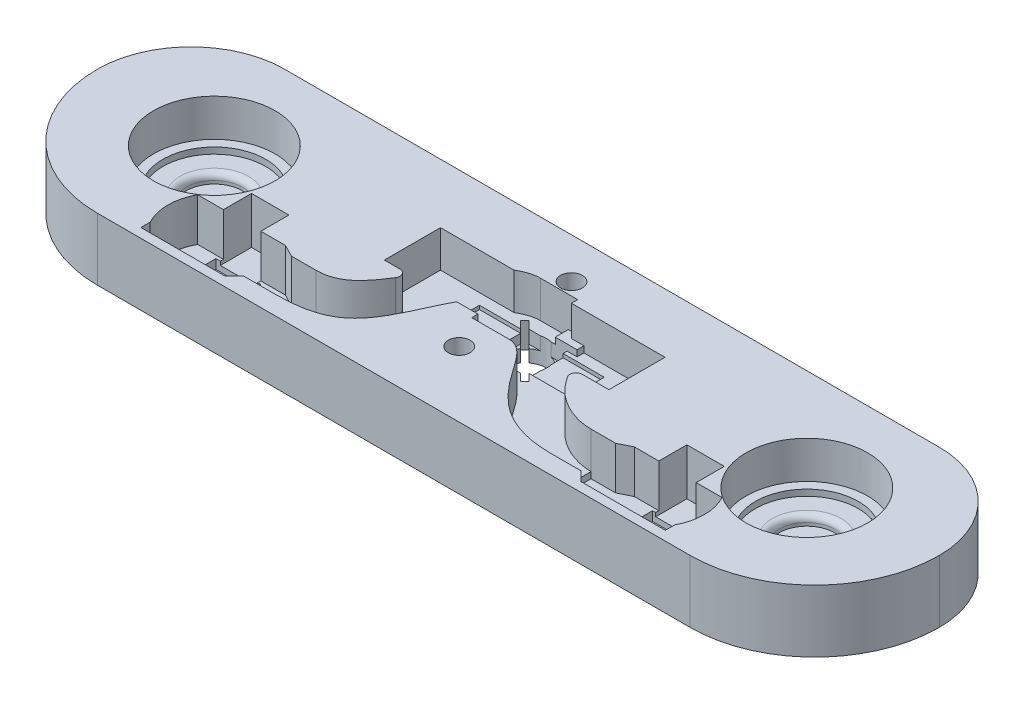
from build123d import *

# Parameters (mm, degrees)
SKETCH1_W                = 135
SKETCH1_H                = 35
BOSS_EXTRUDE1_DEPTH      = 10
FILLET1_R                = 20
CUT_EXTRUDE3_REACH       = 93.483
SKETCH5_R                = 1.75
SKETCH6_R                = 3.1
CUT_EXTRUDE4_DEPTH       = 4
FILLET2_R                = 15
SKETCH3_R                = 9.75
CUT_EXTRUDE5_DEPTH       = 7
BOSS_EXTRUDE2_START      = 1
SKETCH9_R                = 9.75
SKETCH9_R_2              = 8.25
BOSS_EXTRUDE2_DEPTH      = 1
SKETCH10_R               = 4.5
CUT_EXTRUDE6_DEPTH       = 1.5
FILLET3_R                = 1
CUT_EXTRUDE7_REACH       = 93.483
SKETCH7_R                = 2.5
SKETCH11_W               = 7.2
SKETCH11_H               = 6.2
CUT_EXTRUDE8_DEPTH       = 8.4
CUT_EXTRUDE9_DEPTH       = 6.9
CUT_EXTRUDE10_DEPTH      = 5.9
CUT_EXTRUDE11_REACH      = 93.483
SKETCH14_R               = 3.5
CUT_EXTRUDE12_DEPTH      = 5.9
CUT_EXTRUDE12_DEPTH_BACK = 2.1
SKETCH15_W               = 6.8
SKETCH15_H               = 6.8
SKETCH16_W               = 36
SKETCH16_H               = 9
CUT_EXTRUDE13_DEPTH      = 5.9
BOSS_EXTRUDE3_DEPTH      = 1
SKETCH18_W               = 6
SKETCH18_H               = 5
CUT_EXTRUDE14_DEPTH      = 7.5
SKETCH19_W               = 13
SKETCH19_H               = 1.5
CUT_EXTRUDE15_DEPTH      = 6.9
CHAMFER1_SIZE            = 2
FILLET4_R                = 1
CUT_EXTRUDE16_REACH      = 93.196
SKETCH20_R               = 0.7
CUT_EXTRUDE17_START      = -4.1
CUT_EXTRUDE17_DEPTH      = 10
SKETCH22_W               = 20
SKETCH22_H               = 5.5
CUT_EXTRUDE18_DEPTH      = 0.6


# Some blends are built 0.0001 mm under size
with BuildPart() as part:
    # Sketch1 → Boss-Extrude1 (new body)
    with BuildSketch(Plane(origin=(0, 0, 0), x_dir=(1, 0, 0), z_dir=(0, 1, 0))):
        with Locations((19.749798241, -8.123070146)):
            Rectangle(SKETCH1_W, SKETCH1_H)
    extrude(amount=BOSS_EXTRUDE1_DEPTH)

    # Fillet1
    fillet1_edges = [part.edges().sort_by_distance(p)[0] for p in [
        (87.249798241, 5, 25.623070146),
        (-47.750201759, 5, 25.623070146),
    ]]
    fillet(fillet1_edges, radius=FILLET1_R)

    # Sketch5 → Cut-Extrude3 (cut, up to next)
    with BuildSketch(Plane(origin=(0, 10, 0), x_dir=(1, 0, 0), z_dir=(0, 1, 0)), mode=Mode.PRIVATE) as cut_extrude3_sk1:
        with Locations(Location((19.749798241, 2.876929854, 0), (0, 0, 270))):
            Circle(SKETCH5_R)
    cut_extrude3_tool1 = extrude(cut_extrude3_sk1.sketch, amount=-CUT_EXTRUDE3_REACH, mode=Mode.PRIVATE) & part.part
    # Sketch5 → Cut-Extrude3 (cut, up to next)
    with BuildSketch(Plane(origin=(0, 10, 0), x_dir=(1, 0, 0), z_dir=(0, 1, 0)), mode=Mode.PRIVATE) as cut_extrude3_sk2:
        with Locations(Location((19.749798241, -15.123070146, 0), (0, 0, 270))):
            Circle(SKETCH5_R)
    cut_extrude3_tool2 = extrude(cut_extrude3_sk2.sketch, amount=-CUT_EXTRUDE3_REACH, mode=Mode.PRIVATE) & part.part
    add(cut_extrude3_tool1.solids().sort_by_distance((19.749798, 10, -2.87693))[0], mode=Mode.SUBTRACT)
    add(cut_extrude3_tool2.solids().sort_by_distance((19.749798, 10, 15.12307))[0], mode=Mode.SUBTRACT)

    # Sketch6 → Cut-Extrude4 (cut)
    with BuildSketch(Plane.XZ):
        with Locations(Location((19.749798241, 15.123070146, 0), (0, 0, 270))):
            Circle(SKETCH6_R)
        with Locations(Location((19.749798241, -2.876929854, 0), (0, 0, 270))):
            Circle(SKETCH6_R)
    extrude(amount=-CUT_EXTRUDE4_DEPTH, mode=Mode.SUBTRACT)

    # Fillet2
    fillet2_edges = [part.edges().sort_by_distance(p)[0] for p in [
        (-47.750201759, 5, -9.376929854),
        (87.249798241, 5, -9.376929854),
    ]]
    fillet(fillet2_edges, radius=FILLET2_R - 0.0001)  # a hair under: the kernel refuses the full size

    # Sketch3 → Cut-Extrude5 (cut)
    with BuildSketch(Plane(origin=(0, 10, 0), x_dir=(1, 0, 0), z_dir=(0, 1, 0))):
        with Locations(Location((-27.750201759, -6.88629089, 0), (0, 0, 270))):
            Circle(SKETCH3_R)
        with Locations(Location((67.249798241, -6.88629089, 0), (0, 0, 90))):
            Circle(SKETCH3_R)
    extrude(amount=-CUT_EXTRUDE5_DEPTH, mode=Mode.SUBTRACT)

    # Sketch9 → Boss-Extrude2 (add)
    # profile 1 of 2: a face of its own
    with BuildSketch(Plane(origin=(0, 3, 0), x_dir=(1, 0, 0), z_dir=(0, 1, 0)).offset(BOSS_EXTRUDE2_START)):
        with Locations(Location((-27.750201759, -6.88629089, 0), (0, 0, 270))):
            Circle(SKETCH9_R)
        with Locations(Location((-27.750201759, -6.88629089, 0), (0, 0, 270))):
            Circle(SKETCH9_R_2, mode=Mode.SUBTRACT)
    # profile 2 of 2: a face of its own
    with BuildSketch(Plane(origin=(0, 3, 0), x_dir=(1, 0, 0), z_dir=(0, 1, 0)).offset(BOSS_EXTRUDE2_START)):
        with Locations(Location((67.249798241, -6.88629089, 0), (0, 0, 270))):
            Circle(SKETCH9_R)
        with Locations(Location((67.249798241, -6.88629089, 0), (0, 0, 270))):
            Circle(SKETCH9_R_2, mode=Mode.SUBTRACT)
    extrude(amount=-BOSS_EXTRUDE2_DEPTH)

    # Sketch10 → Cut-Extrude6 (cut)
    with BuildSketch(Plane(origin=(0, 3, 0), x_dir=(1, 0, 0), z_dir=(0, 1, 0))):
        with Locations(Location((-27.750201759, -6.88629089, 0), (0, 0, 270))):
            Circle(SKETCH10_R)
        with Locations(Location((67.249798241, -6.88629089, 0), (0, 0, 270))):
            Circle(SKETCH10_R)
    extrude(amount=-CUT_EXTRUDE6_DEPTH, mode=Mode.SUBTRACT)

    # Fillet3
    fillet3_edges = [part.edges().sort_by_distance(p)[0] for p in [
        (-27.750201759, 3, 2.38629089),
        (67.249798241, 3, 2.38629089),
    ]]
    fillet(fillet3_edges, radius=FILLET3_R)

    # Sketch7 → Cut-Extrude7 (cut, up to next)
    with BuildSketch(Plane(origin=(0, 10, 0), x_dir=(1, 0, 0), z_dir=(0, 1, 0)), mode=Mode.PRIVATE) as cut_extrude7_sk1:
        with Locations(Location((-15.250201759, -18.623070146, 0), (0, 0, 270))):
            Circle(SKETCH7_R)
    cut_extrude7_tool1 = extrude(cut_extrude7_sk1.sketch, amount=-CUT_EXTRUDE7_REACH, mode=Mode.PRIVATE) & part.part
    # Sketch7 → Cut-Extrude7 (cut, up to next)
    with BuildSketch(Plane(origin=(0, 10, 0), x_dir=(1, 0, 0), z_dir=(0, 1, 0)), mode=Mode.PRIVATE) as cut_extrude7_sk2:
        with Locations(Location((54.749798241, -18.623070146, 0), (0, 0, 270))):
            Circle(SKETCH7_R)
    cut_extrude7_tool2 = extrude(cut_extrude7_sk2.sketch, amount=-CUT_EXTRUDE7_REACH, mode=Mode.PRIVATE) & part.part
    add(cut_extrude7_tool1.solids().sort_by_distance((-15.250202, 10, 18.62307))[0], mode=Mode.SUBTRACT)
    add(cut_extrude7_tool2.solids().sort_by_distance((54.749798, 10, 18.62307))[0], mode=Mode.SUBTRACT)

    # Sketch11 → Cut-Extrude8 (cut)
    with BuildSketch(Plane(origin=(0, 10, 0), x_dir=(1, 0, 0), z_dir=(0, 1, 0))):
        with Locations((-15.250201759, -18.623070146)):
            Rectangle(SKETCH11_W, SKETCH11_H)
        with Locations((54.749798241, -18.623070146)):
            Rectangle(SKETCH11_W, SKETCH11_H)
    extrude(amount=-CUT_EXTRUDE8_DEPTH, mode=Mode.SUBTRACT)

    # Sketch12 → Cut-Extrude9 (cut)
    with BuildSketch(Plane(origin=(0, 10, 0), x_dir=(1, 0, 0), z_dir=(0, 1, 0))):
        with BuildLine():
            Line((-2.290088122, -16.023070146), (-2.290088122, -22.623070146))
            Line((-2.290088122, -22.623070146), (-22.290088122, -22.623070146))
            ThreePointArc((-22.290088122, -22.623070146), (-23.250201759, -18.823070146), (-22.290088122, -15.023070146))
            Line((-22.290088122, -15.023070146), (-8.226250735, -15.023070146))
            Line((-8.226250735, -15.023070146), (-6.226250735, -16.023070146))
            Line((-6.226250735, -16.023070146), (-2.290088122, -16.023070146))
        make_face()
        with BuildLine():
            Line((45.725847218, -16.023070146), (41.789684604, -16.023070146))
            Line((41.789684604, -16.023070146), (41.789684604, -22.623070146))
            Line((41.789684604, -22.623070146), (61.789684604, -22.623070146))
            ThreePointArc((61.789684604, -22.623070146), (62.749798241, -18.823070146), (61.789684604, -15.023070146))
            Line((61.789684604, -15.023070146), (47.725847218, -15.023070146))
            Line((47.725847218, -15.023070146), (45.725847218, -16.023070146))
        make_face()
    extrude(amount=-CUT_EXTRUDE9_DEPTH, mode=Mode.SUBTRACT)

    # Sketch13 → Cut-Extrude10 (cut)
    with BuildSketch(Plane(origin=(0, 10, 0), x_dir=(1, 0, 0), z_dir=(0, 1, 0))):
        with BuildLine():
            Line((16.749798241, -6.123070146), (16.749798241, -10.123070146))
            Line((16.749798241, -10.123070146), (22.749798241, -10.123070146))
            add(Edge.make_bspline(
                [(22.749798241, -10.123070146), (24.722036045, -10.123070146), (28.163979579, -15.633237451), (33.12171253, -21.326637483), (39.095893997, -22.623070146), (41.789684604, -22.623070146)],
                knots=[0, 0, 0, 0, 0.267210119, 0.665147789, 1, 1, 1, 1], degree=3))
            Line((41.789684604, -22.623070146), (41.789684604, -16.023070146))
            add(Edge.make_bspline(
                [(22.749798241, -3.123070146), (25.404352013, -3.123070146), (30.639958492, -6.486500824), (33.826455572, -13.659608817), (39.207647597, -16.023070146), (41.789684604, -16.023070146)],
                knots=[0, 0, 0, 0, 0.352458843, 0.667620914, 1, 1, 1, 1], degree=3))
            Line((22.749798241, -3.123070146), (22.749798241, 0.876929854))
            Line((22.749798241, 0.876929854), (16.749798241, 0.876929854))
            add(Edge.make_bspline(
                [(-2.290088122, -16.023070146), (1.030690921, -16.023070146), (5.021034942, -11.553320405), (8.441730898, -4.082439458), (13.994609535, 0.876929854), (16.749798241, 0.876929854)],
                knots=[0, 0, 0, 0, 0.303660765, 0.653033126, 1, 1, 1, 1], degree=3))
            Line((-2.290088122, -16.023070146), (-2.290088122, -22.623070146))
            add(Edge.make_bspline(
                [(-2.290088122, -22.623070146), (1.458082619, -22.623070146), (7.085257022, -21.467137706), (11.349322106, -13.849067405), (14.359844143, -6.123070146), (16.749798241, -6.123070146)],
                knots=[0, 0, 0, 0, 0.342742586, 0.656631576, 1, 1, 1, 1], degree=3))
        make_face()
    extrude(amount=-CUT_EXTRUDE10_DEPTH, mode=Mode.SUBTRACT)

    # Sketch14 → Cut-Extrude11 (cut, up to next)
    with BuildSketch(Plane.XZ, mode=Mode.PRIVATE) as cut_extrude11_sk1:
        with Locations(Location((19.749798241, 4.623070146, 0), (0, 0, 270))):
            Circle(SKETCH14_R)
    cut_extrude11_tool1 = extrude(cut_extrude11_sk1.sketch, amount=-CUT_EXTRUDE11_REACH, mode=Mode.PRIVATE) & part.part
    add(cut_extrude11_tool1.solids().sort_by_distance((19.749798, 0, 4.62307))[0], mode=Mode.SUBTRACT)

    # Sketch15 → Cut-Extrude12 (cut, two sides: drawn at the far end of the back side and taken through both)
    with BuildSketch(Plane(origin=(0, 4.1, 0), x_dir=(1, 0, 0), z_dir=(0, 1, 0)).offset(-CUT_EXTRUDE12_DEPTH_BACK)):
        with Locations((19.749798241, -4.623070146)):
            Rectangle(SKETCH15_W, SKETCH15_H)
    extrude(amount=CUT_EXTRUDE12_DEPTH + CUT_EXTRUDE12_DEPTH_BACK, mode=Mode.SUBTRACT)

    # Sketch16 → Cut-Extrude13 (cut)
    with BuildSketch(Plane(origin=(0, 10, 0), x_dir=(1, 0, 0), z_dir=(0, 1, 0))):
        with Locations((19.749798241, -4.623070146)):
            Rectangle(SKETCH16_W, SKETCH16_H)
    extrude(amount=-CUT_EXTRUDE13_DEPTH, mode=Mode.SUBTRACT)

    # Sketch17 → Boss-Extrude3 (add)
    with BuildSketch(Plane(origin=(0, 4.1, 0), x_dir=(1, 0, 0), z_dir=(0, 1, 0))):
        Polygon((14.349798241, -8.023070146), (18.349798241, -8.023070146), (18.349798241, -10.123070146), (16.749798241, -10.123070146), (16.749798241, -9.123070146), (14.349798241, -9.123070146), align=None)
        Polygon((21.249798241, -1.223070146), (24.749798241, -1.223070146), (24.749798241, -0.123070146), (22.749798241, -0.123070146), (22.749798241, 0.876929854), (21.249798241, 0.876929854), align=None)
    extrude(amount=BOSS_EXTRUDE3_DEPTH)

    # Sketch18 → Cut-Extrude14 (cut)
    with BuildSketch(Plane(origin=(0, 10, 0), x_dir=(1, 0, 0), z_dir=(0, 1, 0))):
        with Locations((-15.150201759, -13.023070146)):
            Rectangle(SKETCH18_W, SKETCH18_H)
        with Locations((54.649798241, -13.023070146)):
            Rectangle(SKETCH18_W, SKETCH18_H)
    extrude(amount=-CUT_EXTRUDE14_DEPTH, mode=Mode.SUBTRACT)

    # Sketch19 → Cut-Extrude15 (cut)
    with BuildSketch(Plane(origin=(0, 10, 0), x_dir=(1, 0, 0), z_dir=(0, 1, 0))):
        with Locations((-15.790088122, -23.373070146)):
            Rectangle(SKETCH19_W, SKETCH19_H)
        with Locations((55.289684604, -23.373070146)):
            Rectangle(SKETCH19_W, SKETCH19_H)
    extrude(amount=-CUT_EXTRUDE15_DEPTH, mode=Mode.SUBTRACT)

    # Chamfer1
    # the kernel refuses this chamfer: 2 mm, written as the material it takes off along each edge
    with BuildSketch(Plane(origin=(48.789684604, 15.143365976, 22.623070146), x_dir=(0.027495876610585647, 0, 0.9996219169112968), z_dir=(0, -1, 0))) as chamfer1_piece_1_section:
        Polygon((CHAMFER1_SIZE * 0.999621916911, CHAMFER1_SIZE * 0.0274958766106), (-CHAMFER1_SIZE * 0.0274958766106, CHAMFER1_SIZE * 0.999621916911), (0, 0), align=None)
    chamfer1_piece_1 = extrude(amount=12.043365976, mode=Mode.PRIVATE)
    chamfer1_piece_1 = split(chamfer1_piece_1, bisect_by=Plane(origin=(48.085766383, 9.121682988, 24.123070146), z_dir=(0, 0, -1)), keep=Keep.TOP, mode=Mode.PRIVATE)
    add(chamfer1_piece_1, mode=Mode.SUBTRACT)
    with BuildSketch(Plane(origin=(-9.290088122, 15.143365976, 22.623070146), x_dir=(0.9996219169112968, 0, -0.027495876610585623), z_dir=(0, -1, 0))) as chamfer1_piece_2_section:
        Polygon((CHAMFER1_SIZE * 0.999621916911, CHAMFER1_SIZE * 0.0274958766106), (-CHAMFER1_SIZE * 0.0274958766106, CHAMFER1_SIZE * 0.999621916911), (0, 0), align=None)
    chamfer1_piece_2 = extrude(amount=12.043365976, mode=Mode.PRIVATE)
    chamfer1_piece_2 = split(chamfer1_piece_2, bisect_by=Plane(origin=(-8.586169901, 9.121682988, 24.123070146), z_dir=(0, 0, -1)), keep=Keep.TOP, mode=Mode.PRIVATE)
    add(chamfer1_piece_2, mode=Mode.SUBTRACT)

    # Fillet4
    fillet4_edges = [part.edges().sort_by_distance(p)[0] for p in [
        (31.610186999, 7.05, 9.123070146),
        (6.016620544, 7.05, 9.123070146),
    ]]
    fillet(fillet4_edges, radius=FILLET4_R)

    # Sketch20 → Cut-Extrude16 (cut, up to next)
    with BuildSketch(Plane(origin=(0, 3.1, 0), x_dir=(1, 0, 0), z_dir=(0, 1, 0)), mode=Mode.PRIVATE) as cut_extrude16_sk1:
        with Locations(Location((-20.750201759, -18.623070146, 0), (0, 0, 270))):
            Circle(SKETCH20_R)
    cut_extrude16_tool1 = extrude(cut_extrude16_sk1.sketch, amount=-CUT_EXTRUDE16_REACH, mode=Mode.PRIVATE) & part.part
    # Sketch20 → Cut-Extrude16 (cut, up to next)
    with BuildSketch(Plane(origin=(0, 3.1, 0), x_dir=(1, 0, 0), z_dir=(0, 1, 0)), mode=Mode.PRIVATE) as cut_extrude16_sk2:
        with Locations(Location((-9.750201759, -18.623070146, 0), (0, 0, 270))):
            Circle(SKETCH20_R)
    cut_extrude16_tool2 = extrude(cut_extrude16_sk2.sketch, amount=-CUT_EXTRUDE16_REACH, mode=Mode.PRIVATE) & part.part
    # Sketch20 → Cut-Extrude16 (cut, up to next)
    with BuildSketch(Plane(origin=(0, 3.1, 0), x_dir=(1, 0, 0), z_dir=(0, 1, 0)), mode=Mode.PRIVATE) as cut_extrude16_sk3:
        with Locations(Location((49.249798241, -18.623070146, 0), (0, 0, 270))):
            Circle(SKETCH20_R)
    cut_extrude16_tool3 = extrude(cut_extrude16_sk3.sketch, amount=-CUT_EXTRUDE16_REACH, mode=Mode.PRIVATE) & part.part
    # Sketch20 → Cut-Extrude16 (cut, up to next)
    with BuildSketch(Plane(origin=(0, 3.1, 0), x_dir=(1, 0, 0), z_dir=(0, 1, 0)), mode=Mode.PRIVATE) as cut_extrude16_sk4:
        with Locations(Location((60.249798241, -18.623070146, 0), (0, 0, 270))):
            Circle(SKETCH20_R)
    cut_extrude16_tool4 = extrude(cut_extrude16_sk4.sketch, amount=-CUT_EXTRUDE16_REACH, mode=Mode.PRIVATE) & part.part
    add(cut_extrude16_tool1.solids().sort_by_distance((-20.750202, 3.1, 18.62307))[0], mode=Mode.SUBTRACT)
    add(cut_extrude16_tool2.solids().sort_by_distance((-9.750202, 3.1, 18.62307))[0], mode=Mode.SUBTRACT)
    add(cut_extrude16_tool3.solids().sort_by_distance((49.249798, 3.1, 18.62307))[0], mode=Mode.SUBTRACT)
    add(cut_extrude16_tool4.solids().sort_by_distance((60.249798, 3.1, 18.62307))[0], mode=Mode.SUBTRACT)

    # Sketch21 → Cut-Extrude17 (cut)
    with BuildSketch(Plane(origin=(0, 4.1, 0), x_dir=(1, 0, 0), z_dir=(0, 1, 0)).offset(CUT_EXTRUDE17_START)):
        Polygon((15.153604163, -0.73398285), (23.638885538, -9.219264224), (24.345992319, -8.512157443), (15.860710945, -0.026876069), align=None)
    extrude(amount=CUT_EXTRUDE17_DEPTH, mode=Mode.SUBTRACT)

    # Sketch22 → Cut-Extrude18 (cut)
    with BuildSketch(Plane(origin=(0, 4.1, 0), x_dir=(1, 0, 0), z_dir=(0, 1, 0))):
        with Locations((19.749798241, -4.623070146)):
            Rectangle(SKETCH22_W, SKETCH22_H)
    extrude(amount=-CUT_EXTRUDE18_DEPTH, mode=Mode.SUBTRACT)


solid = part.part
